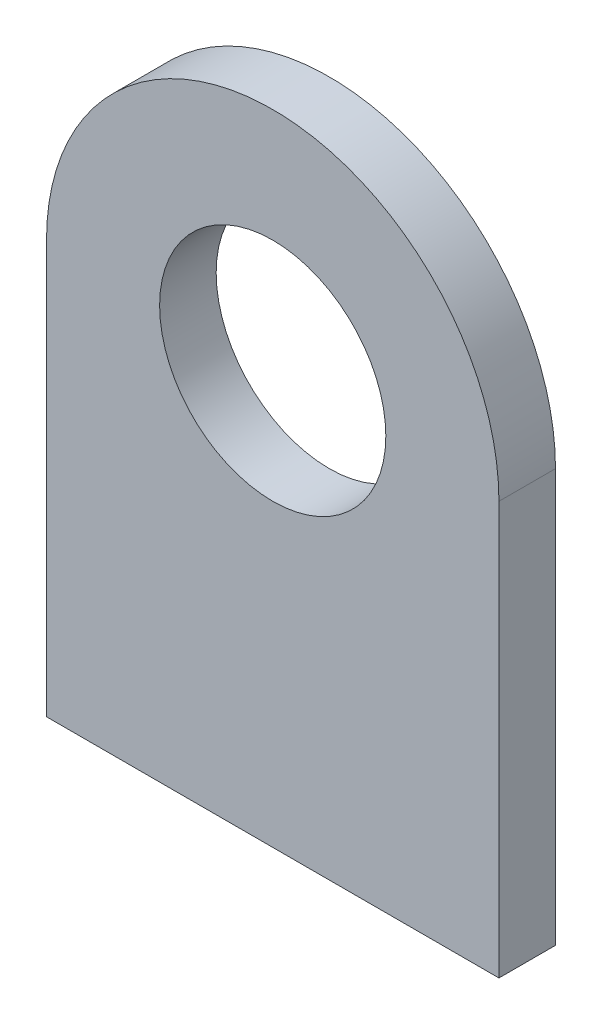
from build123d import *

# Parameters (mm, degrees)
SKETCH1_R           = 6.35
BOSS_EXTRUDE1_DEPTH = 3.175


with BuildPart() as part:
    # Sketch1 → Boss-Extrude1 (new body)
    with BuildSketch(Plane.XY):
        with BuildLine():
            Line((7.987675642, 20.35683), (7.987675642, -2.82067))
            Line((7.987675642, -2.82067), (33.387675642, -2.82067))
            Line((33.387675642, -2.82067), (33.387675642, 20.35683))
            ThreePointArc((33.387675642, 20.35683), (20.687675642, 33.05683), (7.987675642, 20.35683))
        make_face()
        with Locations((20.687675642, 20.35683)):
            Circle(SKETCH1_R, mode=Mode.SUBTRACT)
    extrude(amount=BOSS_EXTRUDE1_DEPTH)


solid = part.part
